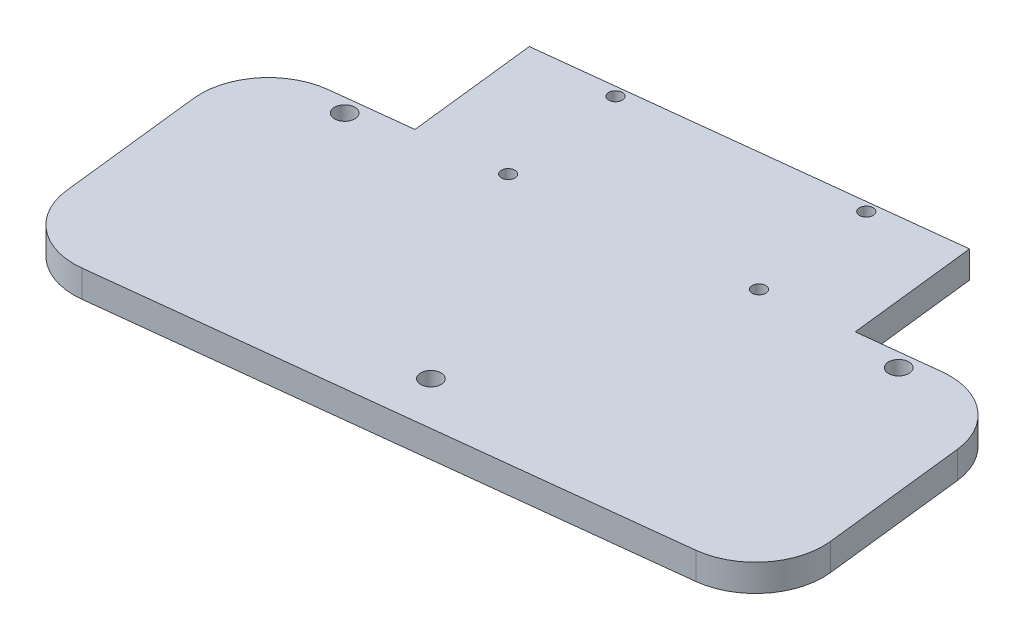
from build123d import *

# Parameters (mm, degrees)
SKETCH1_R           = 1.5
SKETCH1_R_2         = 1
BOSS_EXTRUDE1_DEPTH = 4
FILLET1_R           = 10
FILLET2_R           = 10
FILLET3_R           = 10
FILLET4_R           = 10


with BuildPart() as part:
    # Sketch1 → Boss-Extrude1 (new body)
    with BuildSketch(Plane(origin=(0, 0, 0), x_dir=(1, 0, 0), z_dir=(0, 1, 0))):
        Polygon((-43.595803766, -205.807188304), (-22.135109681, -203.371959758), (-24.298008335, -184.311199966), (34.130185477, -177.681125241), (36.293084131, -196.741885032), (57.753778216, -194.306656487), (62.409879754, -235.339014996), (-38.939702228, -246.839546813), align=None)
        with Locations((-29.431391649, -206.464309837)):
            Circle(SKETCH1_R, mode=Mode.SUBTRACT)
        with Locations((44.096736456, -198.120786754)):
            Circle(SKETCH1_R, mode=Mode.SUBTRACT)
        with Locations((10.940682385, -234.088495584)):
            Circle(SKETCH1_R, mode=Mode.SUBTRACT)
        with Locations((-9.536019379, -202.193869315)):
            Circle(SKETCH1_R_2, mode=Mode.SUBTRACT)
        with Locations((-11.565016966, -184.313126014)):
            Circle(SKETCH1_R_2, mode=Mode.SUBTRACT)
        with Locations((21.721365352, -180.535990565)):
            Circle(SKETCH1_R_2, mode=Mode.SUBTRACT)
        with Locations((23.750362938, -198.416733865)):
            Circle(SKETCH1_R_2, mode=Mode.SUBTRACT)
    extrude(amount=BOSS_EXTRUDE1_DEPTH)

    # Fillet1
    fillet1_edges = [part.edges().sort_by_distance(p)[0] for p in [
        (-38.939702228, 2, 246.839546813),
    ]]
    fillet(fillet1_edges, radius=FILLET1_R)

    # Fillet2
    fillet2_edges = [part.edges().sort_by_distance(p)[0] for p in [
        (62.409879754, 2, 235.339014996),
    ]]
    fillet(fillet2_edges, radius=FILLET2_R)

    # Fillet3
    fillet3_edges = [part.edges().sort_by_distance(p)[0] for p in [
        (57.753778216, 2, 194.306656487),
    ]]
    fillet(fillet3_edges, radius=FILLET3_R)

    # Fillet4
    fillet4_edges = [part.edges().sort_by_distance(p)[0] for p in [
        (-43.595803766, 2, 205.807188304),
    ]]
    fillet(fillet4_edges, radius=FILLET4_R)


solid = part.part
